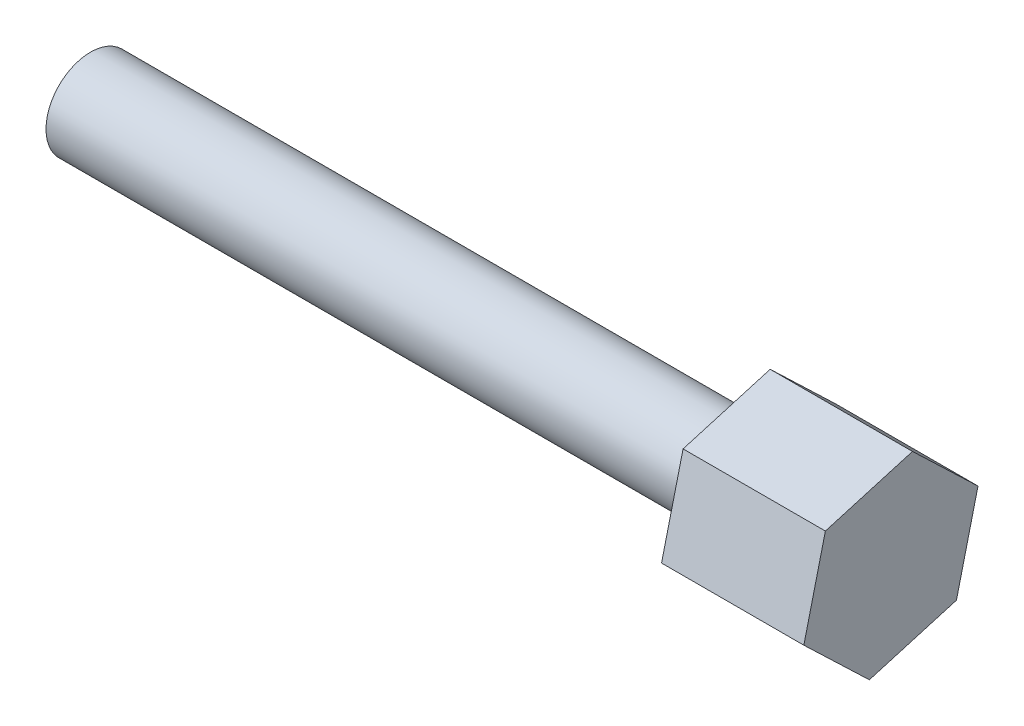
from build123d import *

# Parameters (mm, degrees)
SKETCH1_R           = 3.175
BOSS_EXTRUDE2_DEPTH = 46.99
BOSS_EXTRUDE3_DEPTH = 10.16
SKETCH3_R           = 3.175
SKETCH3_R_2         = 1.778
CUT_EXTRUDE1_DEPTH  = 19.05
SKETCH6_R           = 3.175
BOSS_EXTRUDE5_DEPTH = 49.022
CUT_EXTRUDE5_DEPTH  = 38.1


with BuildPart() as part:
    # Sketch1 → Boss-Extrude2 (new body)
    with BuildSketch(Plane(origin=(0, 0, 0), x_dir=(0, 0, -1), z_dir=(1, 0, 0))):
        Circle(SKETCH1_R)
    extrude(amount=BOSS_EXTRUDE2_DEPTH)

    # Sketch2 → Boss-Extrude3 (add)
    with BuildSketch(Plane(origin=(46.99, 0, 0), x_dir=(0, 0, -1), z_dir=(1, 0, 0))):
        Polygon((-4.67882504, 4.478159594), (-6.217612491, -1.812901548), (-1.538787451, -6.291061142), (4.67882504, -4.478159594), (6.217612491, 1.812901548), (1.538787451, 6.291061142), align=None)
    extrude(amount=BOSS_EXTRUDE3_DEPTH)

    # Sketch3 → Cut-Extrude1 (cut)
    with BuildSketch(Plane.ZY):
        Circle(SKETCH3_R)
        Circle(SKETCH3_R_2, mode=Mode.SUBTRACT)
    extrude(amount=-CUT_EXTRUDE1_DEPTH, mode=Mode.SUBTRACT)

    # Sketch6 → Boss-Extrude5 (add)
    with BuildSketch(Plane.ZY):
        Circle(SKETCH6_R)
    extrude(amount=-BOSS_EXTRUDE5_DEPTH)

    # Sketch7 → Cut-Extrude5 (cut)
    with BuildSketch(Plane.ZY):
        Polygon((-0.489261374, 0.714579112), (-0.863474351, -0.066423223), (-0.374212977, -0.781002335), (0.489261374, -0.714579112), (0.863474351, 0.066423223), (0.374212977, 0.781002335), align=None)
    extrude(amount=-CUT_EXTRUDE5_DEPTH, mode=Mode.SUBTRACT)


solid = part.part
